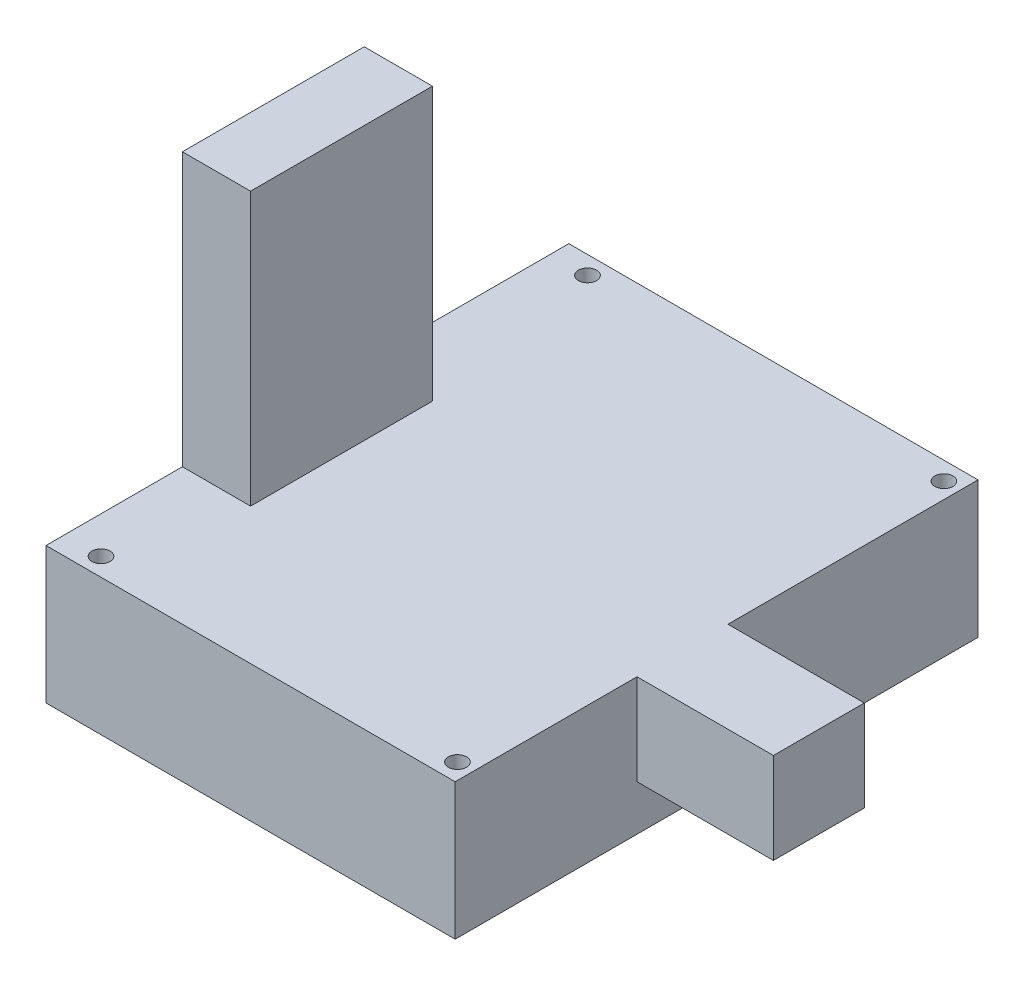
from build123d import *

# Parameters (mm, degrees)
SKETCH_1_W              = 90
SKETCH_1_H              = 30
EXTRUDE_1_DEPTH         = 115
SKETCH_3_W              = 20
SKETCH_3_H              = 20
EXTRUDE_2_DEPTH         = 30
SKETCH_4_W              = 15
SKETCH_4_H              = 40
EXTRUDE_3_DEPTH         = 60
CUT_EXTRUDE_1_OUTLINE_R = 2
CUT_EXTRUDE_1_DEPTH     = 30


# Read off the part's stored shape, not the designer's step: 切除-拉伸1
with BuildPart() as part:
    # 草图1 → 凸台-拉伸1 (new body)
    with BuildSketch(Plane.XY):
        with Locations((0, 15)):
            Rectangle(SKETCH_1_W, SKETCH_1_H)
    extrude(amount=EXTRUDE_1_DEPTH)

    # 草图3 → 凸台-拉伸2 (add)
    with BuildSketch(Plane(origin=(45, 0, 0), x_dir=(0, 0, -1), z_dir=(1, 0, 0))):
        with Locations((-65, 20)):
            Rectangle(SKETCH_3_W, SKETCH_3_H)
    extrude(amount=EXTRUDE_2_DEPTH)

    # 草图4 → 凸台-拉伸3 (add)
    with BuildSketch(Plane(origin=(0, 30, 0), x_dir=(1, 0, 0), z_dir=(0, 1, 0))):
        with Locations((-37.5, -65)):
            Rectangle(SKETCH_4_W, SKETCH_4_H)
    extrude(amount=EXTRUDE_3_DEPTH)

    # 切除-拉伸1 outline → 切除-拉伸1 (cut)
    with BuildSketch(Plane(origin=(0, 0, 0), x_dir=(1, 0, 0), z_dir=(0, 1, 0))):
        with Locations((41.5, -4)):
            Circle(CUT_EXTRUDE_1_OUTLINE_R)
        with Locations((-36.9, -4)):
            Circle(CUT_EXTRUDE_1_OUTLINE_R)
        with Locations((-36.9, -111)):
            Circle(CUT_EXTRUDE_1_OUTLINE_R)
        with Locations((41.5, -111)):
            Circle(CUT_EXTRUDE_1_OUTLINE_R)
    extrude(amount=CUT_EXTRUDE_1_DEPTH, mode=Mode.SUBTRACT)


solid = part.part
